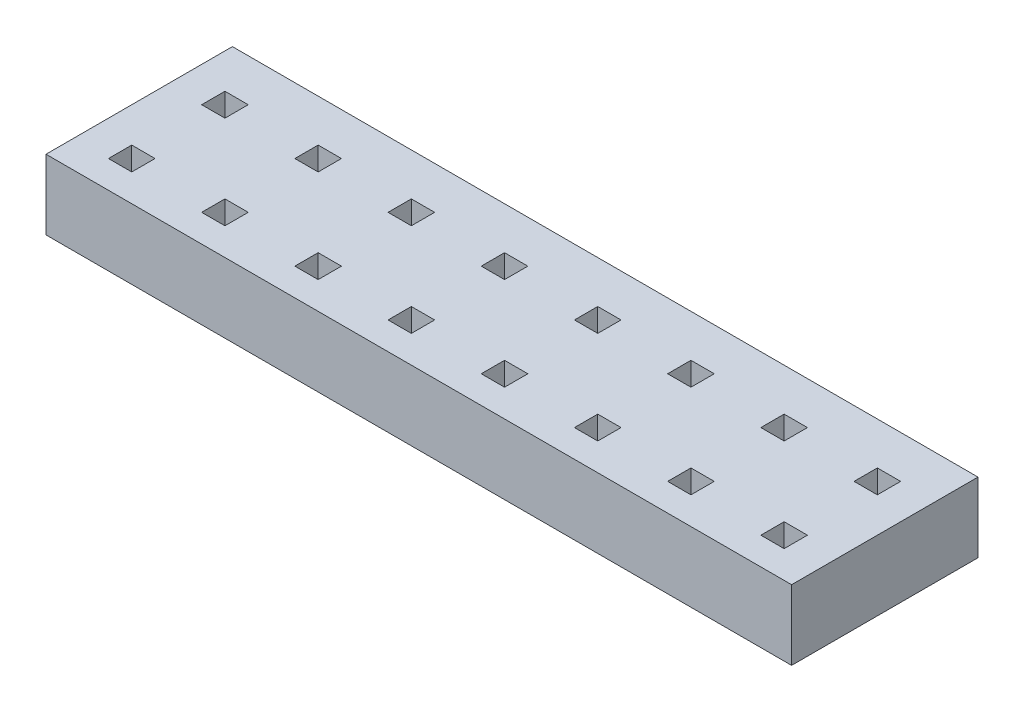
from build123d import *

# Parameters (mm, degrees)
SKETCH1_W           = 16
SKETCH1_H           = 4
BOSS_EXTRUDE1_DEPTH = 1.5
SKETCH2_W           = 0.5
SKETCH2_H           = 0.5
CUT_EXTRUDE1_DEPTH  = 2


with BuildPart() as part:
    # Sketch1 → Boss-Extrude1 (new body)
    with BuildSketch(Plane(origin=(0, 0, 0), x_dir=(1, 0, 0), z_dir=(0, 1, 0))):
        with Locations((8, 2)):
            Rectangle(SKETCH1_W, SKETCH1_H)
    extrude(amount=BOSS_EXTRUDE1_DEPTH)

    # Sketch2 → Cut-Extrude1 (cut)
    with BuildSketch(Plane(origin=(0, 1.5, 0), x_dir=(1, 0, 0), z_dir=(0, 1, 0))):
        with Locations((3, 2.84)):
            Rectangle(SKETCH2_W, SKETCH2_H)
        with Locations((1, 2.84)):
            Rectangle(SKETCH2_W, SKETCH2_H)
        with Locations((5, 2.84)):
            Rectangle(SKETCH2_W, SKETCH2_H)
        with Locations((7, 2.84)):
            Rectangle(SKETCH2_W, SKETCH2_H)
        with Locations((9, 2.84)):
            Rectangle(SKETCH2_W, SKETCH2_H)
        with Locations((11, 2.84)):
            Rectangle(SKETCH2_W, SKETCH2_H)
        with Locations((13, 2.84)):
            Rectangle(SKETCH2_W, SKETCH2_H)
        with Locations((15, 2.84)):
            Rectangle(SKETCH2_W, SKETCH2_H)
        with Locations((17, 2.84)):
            Rectangle(SKETCH2_W, SKETCH2_H)
        with Locations((19, 2.84)):
            Rectangle(SKETCH2_W, SKETCH2_H)
        with Locations((21, 2.84)):
            Rectangle(SKETCH2_W, SKETCH2_H)
        with Locations((23, 2.84)):
            Rectangle(SKETCH2_W, SKETCH2_H)
        with Locations((25, 2.84)):
            Rectangle(SKETCH2_W, SKETCH2_H)
        with Locations((27, 2.84)):
            Rectangle(SKETCH2_W, SKETCH2_H)
        with Locations((29, 2.84)):
            Rectangle(SKETCH2_W, SKETCH2_H)
        with Locations((31, 2.84)):
            Rectangle(SKETCH2_W, SKETCH2_H)
        with Locations((33, 2.84)):
            Rectangle(SKETCH2_W, SKETCH2_H)
        with Locations((35, 2.84)):
            Rectangle(SKETCH2_W, SKETCH2_H)
        with Locations((1, 0.84)):
            Rectangle(SKETCH2_W, SKETCH2_H)
        with Locations((3, 0.84)):
            Rectangle(SKETCH2_W, SKETCH2_H)
        with Locations((5, 0.84)):
            Rectangle(SKETCH2_W, SKETCH2_H)
        with Locations((7, 0.84)):
            Rectangle(SKETCH2_W, SKETCH2_H)
        with Locations((9, 0.84)):
            Rectangle(SKETCH2_W, SKETCH2_H)
        with Locations((11, 0.84)):
            Rectangle(SKETCH2_W, SKETCH2_H)
        with Locations((13, 0.84)):
            Rectangle(SKETCH2_W, SKETCH2_H)
        with Locations((15, 0.84)):
            Rectangle(SKETCH2_W, SKETCH2_H)
        with Locations((17, 0.84)):
            Rectangle(SKETCH2_W, SKETCH2_H)
        with Locations((19, 0.84)):
            Rectangle(SKETCH2_W, SKETCH2_H)
        with Locations((21, 0.84)):
            Rectangle(SKETCH2_W, SKETCH2_H)
        with Locations((23, 0.84)):
            Rectangle(SKETCH2_W, SKETCH2_H)
        with Locations((25, 0.84)):
            Rectangle(SKETCH2_W, SKETCH2_H)
        with Locations((27, 0.84)):
            Rectangle(SKETCH2_W, SKETCH2_H)
        with Locations((29, 0.84)):
            Rectangle(SKETCH2_W, SKETCH2_H)
        with Locations((31, 0.84)):
            Rectangle(SKETCH2_W, SKETCH2_H)
        with Locations((33, 0.84)):
            Rectangle(SKETCH2_W, SKETCH2_H)
        with Locations((35, 0.84)):
            Rectangle(SKETCH2_W, SKETCH2_H)
    extrude(amount=-CUT_EXTRUDE1_DEPTH, mode=Mode.SUBTRACT)


solid = part.part
